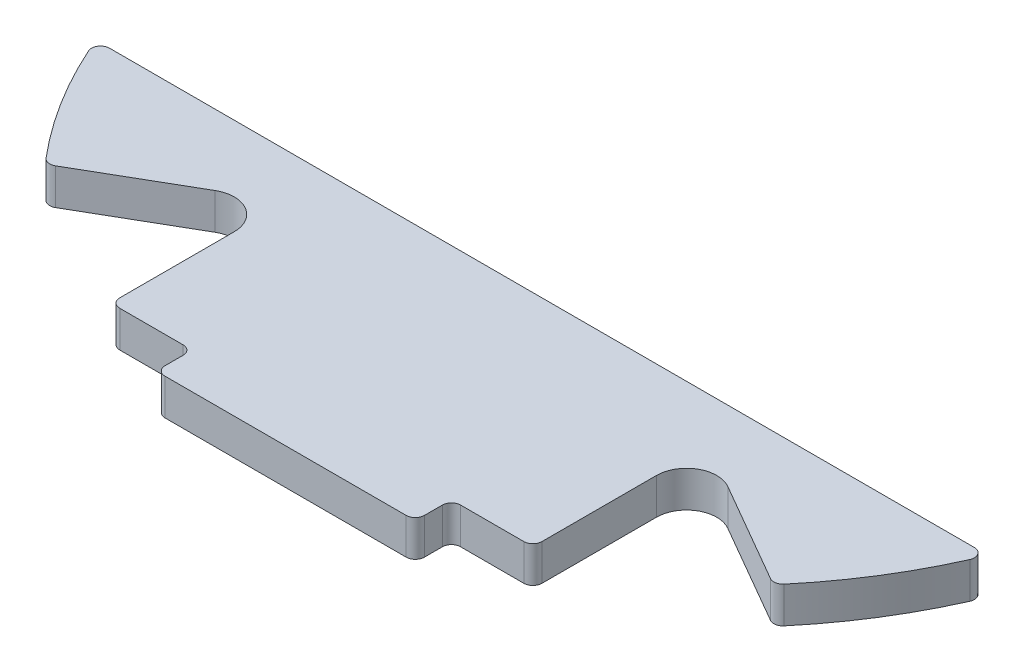
from build123d import *

# Parameters (mm, degrees)
T_LE_DE_BASE_PLI_E1_DEPTH = 12
CONG_1_R                  = 10
CONG_2_R                  = 3


# Sheet-metal steps are written as plain solids
with BuildPart() as part:
    # Esquisse1 → Tôle de base pliée1 (new body)
    with BuildSketch(Plane(origin=(0, 0, 0), x_dir=(1, 0, 0), z_dir=(0, 1, 0))):
        with BuildLine():
            Line((0, 0), (0, 85))
            Line((0, 85), (147.915516427, 85))
            ThreePointArc((147.915516427, 85), (136.110968197, 61.894088575), (120.726964676, 41))
            Line((120.726964676, 41), (70, 70.287226711))
            Line((70, 70.287226711), (70, 12))
            Line((70, 12), (43, 12))
            Line((43, 12), (43, 0))
            Line((43, 0), (0, 0))
        make_face()
    extrude(amount=T_LE_DE_BASE_PLI_E1_DEPTH)

    # Congé1
    cong_1_edges = [part.edges().sort_by_distance(p)[0] for p in [
        (70, 6, -70.287226711),
    ]]
    fillet(cong_1_edges, radius=CONG_1_R)

    # Congé2
    cong_2_edges = [part.edges().sort_by_distance(p)[0] for p in [
        (147.915516427, 6, -85),
        (120.726964676, 6, -41),
        (70, 6, -12),
        (43, 6, -12),
        (43, 6, 0),
    ]]
    fillet(cong_2_edges, radius=CONG_2_R)

    # Symétrie1: part across plane


with BuildPart() as part_1:
    add(part.part)
    add(part.part.mirror(Plane(origin=(0, 12, 0), x_dir=(0, 0, 1), z_dir=(1, 0, 0))))


solid = part_1.part
